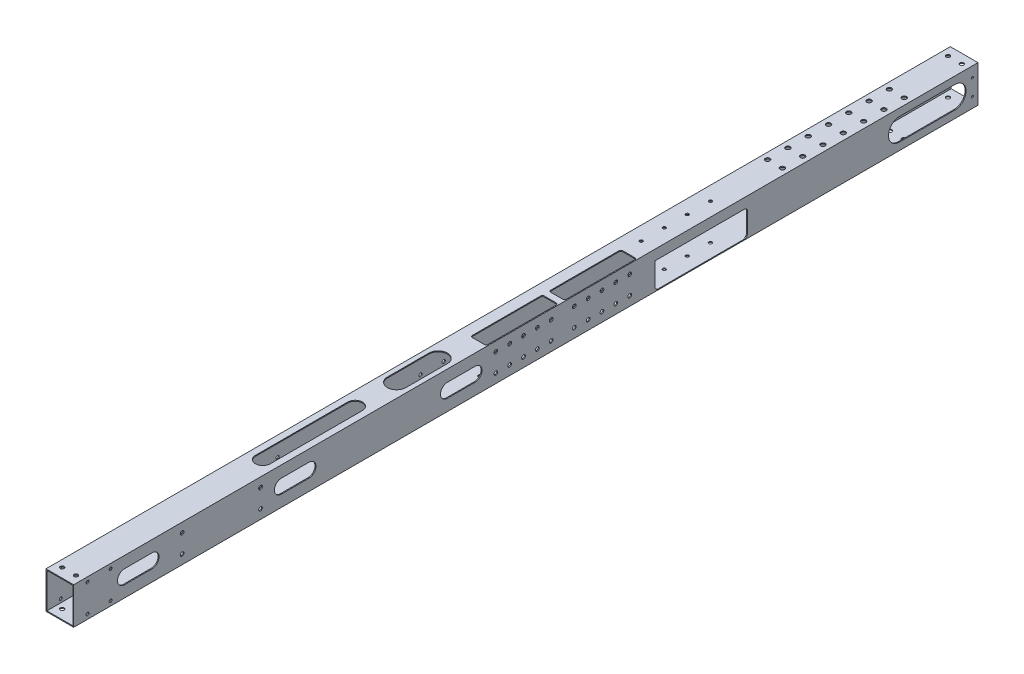
from build123d import *

# Parameters (mm, degrees)
SKETCH_1_W           = 30
SKETCH_1_H           = 40
SKETCH_1_W_2         = 28
SKETCH_1_H_2         = 38
EXTRUDE_1_DEPTH      = 940
SKETCH_5_R           = 2.5
CUT_EXTRUDE_3_DEPTH  = 941.97024395
CUT_EXTRUDE_4_DEPTH  = 1
SKETCH_7_R           = 1.75
CUT_EXTRUDE_5_DEPTH  = 1
SKETCH_17_W          = 30
SKETCH_17_H          = 40
SKETCH_17_W_2        = 28
SKETCH_17_H_2        = 38
EXTRUDE_2_DEPTH      = 20
SKETCH_18_W          = 30
SKETCH_18_H          = 40
SKETCH_18_W_2        = 28
SKETCH_18_H_2        = 38
EXTRUDE_3_DEPTH      = 20
SKETCH_19_R          = 2.1
CUT_EXTRUDE_16_DEPTH = 961.950050731
SKETCH_20_R          = 1.6
CUT_EXTRUDE_17_DEPTH = 961.67684473
SKETCH_26_R          = 2
CUT_EXTRUDE_22_DEPTH = 961.67684473
CUT_EXTRUDE_START    = -20
SKETCH_34_R          = 1.75
CUT_EXTRUDE_29_DEPTH = 20
SKETCH_35_R          = 1.5
CUT_EXTRUDE_30_DEPTH = 10
CUT_EXTRUDE_31_DEPTH = 10
SKETCH_37_R          = 1.65
CUT_EXTRUDE_32_DEPTH = 52
SKETCH_40_W          = 100
SKETCH_40_H          = 28
CUT_EXTRUDE_34_DEPTH = 10
EXTRUDE_5_DEPTH      = 1
SKETCH_43_W          = 38.522995696
SKETCH_43_H          = 13.00002022
EXTRUDE_6_DEPTH      = 1
FILLET_1_R           = 3
CUT_EXTRUDE_35_DEPTH = 10
SKETCH_45_R          = 1.1
CUT_EXTRUDE_36_DEPTH = 71
CUT_EXTRUDE_37_DEPTH = 10
SKETCH_47_W          = 19.401524295
SKETCH_47_H          = 15.190340728
EXTRUDE_7_DEPTH      = 1
SKETCH_48_R          = 2
CUT_EXTRUDE_38_DEPTH = 51
CUT_EXTRUDE_39_DEPTH = 11
SKETCH_51_W          = 17
SKETCH_51_H          = 78
CUT_EXTRUDE_40_DEPTH = 11
FILLET_2_R           = 2


with BuildPart() as part:
    # 草图1 → 凸台-拉伸1 (new body)
    with BuildSketch(Plane.XY):
        Rectangle(SKETCH_1_W, SKETCH_1_H)
        Rectangle(SKETCH_1_W_2, SKETCH_1_H_2, mode=Mode.SUBTRACT)
    extrude(amount=EXTRUDE_1_DEPTH)

    # 草图5 → 切除-拉伸3 (cut, through all)
    with BuildSketch(Plane.XZ.offset(20)):
        with Locations((-8, 53)):
            Circle(SKETCH_5_R)
        with Locations((8, 53)):
            Circle(SKETCH_5_R)
        with Locations((-8, 97)):
            Circle(SKETCH_5_R)
        with Locations((8, 97)):
            Circle(SKETCH_5_R)
        with Locations((-8, 119)):
            Circle(SKETCH_5_R)
        with Locations((8, 119)):
            Circle(SKETCH_5_R)
        with Locations((-8, 141)):
            Circle(SKETCH_5_R)
        with Locations((8, 141)):
            Circle(SKETCH_5_R)
        with Locations((-8, 163)):
            Circle(SKETCH_5_R)
        with Locations((8, 163)):
            Circle(SKETCH_5_R)
        with Locations((-8, 185)):
            Circle(SKETCH_5_R)
        with Locations((8, 185)):
            Circle(SKETCH_5_R)
        with Locations((-8, 75)):
            Circle(SKETCH_5_R)
        with Locations((8, 75)):
            Circle(SKETCH_5_R)
    extrude(amount=-CUT_EXTRUDE_3_DEPTH, mode=Mode.SUBTRACT)

    # 草图6 → 切除-拉伸4 (cut)
    with BuildSketch(Plane(origin=(15, 0, 0), x_dir=(0, 0, -1), z_dir=(1, 0, 0))):
        with BuildLine():
            Line((-345, -7.5), (-375, -7.5))
            ThreePointArc((-375, -7.5), (-382.5, 0), (-375, 7.5))
            Line((-375, 7.5), (-345, 7.5))
            ThreePointArc((-345, 7.5), (-337.5, 0), (-345, -7.5))
        make_face()
        with BuildLine():
            Line((-525, -7.5), (-555, -7.5))
            ThreePointArc((-555, -7.5), (-562.5, 0), (-555, 7.5))
            Line((-555, 7.5), (-525, 7.5))
            ThreePointArc((-525, 7.5), (-517.5, 0), (-525, -7.5))
        make_face()
        with BuildLine():
            Line((-705, -7.5), (-735, -7.5))
            ThreePointArc((-735, -7.5), (-742.5, 0), (-735, 7.5))
            Line((-735, 7.5), (-705, 7.5))
            ThreePointArc((-705, 7.5), (-697.5, 0), (-705, -7.5))
        make_face()
    extrude(amount=-CUT_EXTRUDE_4_DEPTH, mode=Mode.SUBTRACT)

    # 草图7 → 切除-拉伸5 (cut)
    with BuildSketch(Plane.ZY.offset(15)):
        with Locations((350, 0)):
            Circle(SKETCH_7_R)
        with Locations((375, 0)):
            Circle(SKETCH_7_R)
        with Locations((530, 0)):
            Circle(SKETCH_7_R)
        with Locations((555, 0)):
            Circle(SKETCH_7_R)
        with Locations((710, 0)):
            Circle(SKETCH_7_R)
        with Locations((735, 0)):
            Circle(SKETCH_7_R)
    extrude(amount=-CUT_EXTRUDE_5_DEPTH, mode=Mode.SUBTRACT)

    # 草图17 → 凸台-拉伸2 (add)
    with BuildSketch(Plane.XY.offset(940)):
        Rectangle(SKETCH_17_W, SKETCH_17_H)
        Rectangle(SKETCH_17_W_2, SKETCH_17_H_2, mode=Mode.SUBTRACT)
    extrude(amount=EXTRUDE_2_DEPTH)

    # 草图18 → 凸台-拉伸3 (add)
    with BuildSketch(Plane(origin=(0, 0, 0), x_dir=(-1, 0, 0), z_dir=(0, 0, -1))):
        Rectangle(SKETCH_18_W, SKETCH_18_H)
        Rectangle(SKETCH_18_W_2, SKETCH_18_H_2, mode=Mode.SUBTRACT)
    extrude(amount=EXTRUDE_3_DEPTH)

    # 草图19 → 切除-拉伸16 (cut, through all)
    with BuildSketch(Plane(origin=(0, 20, 0), x_dir=(1, 0, 0), z_dir=(0, 1, 0))):
        with Locations((-7.5, -950)):
            Circle(SKETCH_19_R)
        with Locations((7.5, -950)):
            Circle(SKETCH_19_R)
        with Locations((-7.5, 10)):
            Circle(SKETCH_19_R)
        with Locations((7.5, 10)):
            Circle(SKETCH_19_R)
    extrude(amount=-CUT_EXTRUDE_16_DEPTH, mode=Mode.SUBTRACT)

    # 草图20 → 切除-拉伸17 (cut, through all)
    with BuildSketch(Plane(origin=(15, 0, 0), x_dir=(0, 0, -1), z_dir=(1, 0, 0))):
        with Locations((-945, 15)):
            Circle(SKETCH_20_R)
        with Locations((-920, 15)):
            Circle(SKETCH_20_R)
        with Locations((-920, -15)):
            Circle(SKETCH_20_R)
        with Locations((-945, -15)):
            Circle(SKETCH_20_R)
    extrude(amount=-CUT_EXTRUDE_17_DEPTH, mode=Mode.SUBTRACT)

    # 草图26 → 切除-拉伸22 (cut, through all)
    with BuildSketch(Plane(origin=(15, 0, 0), x_dir=(0, 0, -1), z_dir=(1, 0, 0))):
        with Locations((-842.5, 10)):
            Circle(SKETCH_26_R)
        with Locations((-842.5, -10)):
            Circle(SKETCH_26_R)
        with Locations((-757.5, -10)):
            Circle(SKETCH_26_R)
        with Locations((-757.5, 10)):
            Circle(SKETCH_26_R)
    extrude(amount=-CUT_EXTRUDE_22_DEPTH, mode=Mode.SUBTRACT)

    # 草图34 → 切除-拉伸29 (cut)
    with BuildSketch(Plane(origin=(15, 0, 0), x_dir=(0, 0, -1), z_dir=(1, 0, 0)).offset(CUT_EXTRUDE_START)):
        with Locations((-905, 0)):
            Circle(SKETCH_34_R)
        with Locations((-880, 0)):
            Circle(SKETCH_34_R)
    extrude(amount=-CUT_EXTRUDE_29_DEPTH, mode=Mode.SUBTRACT)

    # 草图35 → 切除-拉伸30 (cut)
    with BuildSketch(Plane.XZ.offset(20)):
        with Locations((5, 720)):
            Circle(SKETCH_35_R)
        with Locations((5, 700)):
            Circle(SKETCH_35_R)
        with Locations((5, 680)):
            Circle(SKETCH_35_R)
        with Locations((5, 660)):
            Circle(SKETCH_35_R)
        with Locations((5, 640)):
            Circle(SKETCH_35_R)
        with Locations((5, 740)):
            Circle(SKETCH_35_R)
    extrude(amount=-CUT_EXTRUDE_30_DEPTH, mode=Mode.SUBTRACT)

    # 草图36 → 切除-拉伸31 (cut)
    with BuildSketch(Plane(origin=(0, 20, 0), x_dir=(1, 0, 0), z_dir=(0, 1, 0))):
        with BuildLine():
            Line((8, -640), (8, -740))
            ThreePointArc((8, -740), (0, -748), (-8, -740))
            Line((-8, -740), (-8, -640))
            ThreePointArc((-8, -640), (0, -632), (8, -640))
        make_face()
    extrude(amount=-CUT_EXTRUDE_31_DEPTH, mode=Mode.SUBTRACT)

    # 草图37 → 切除-拉伸32 (cut)
    with BuildSketch(Plane(origin=(0, 20, 0), x_dir=(1, 0, 0), z_dir=(0, 1, 0))):
        with Locations((0, -255)):
            Circle(SKETCH_37_R)
        with Locations((0, -280)):
            Circle(SKETCH_37_R)
        with Locations((0, -330)):
            Circle(SKETCH_37_R)
        with Locations((0, -305)):
            Circle(SKETCH_37_R)
        with Locations((0, -355)):
            Circle(SKETCH_37_R)
        with Locations((0, -380)):
            Circle(SKETCH_37_R)
        with Locations((0, -405)):
            Circle(SKETCH_37_R)
        with Locations((0, -455)):
            Circle(SKETCH_37_R)
        with Locations((0, -480)):
            Circle(SKETCH_37_R)
        with Locations((0, -505)):
            Circle(SKETCH_37_R)
        with Locations((0, -555)):
            Circle(SKETCH_37_R)
        with Locations((0, -580)):
            Circle(SKETCH_37_R)
    extrude(amount=-CUT_EXTRUDE_32_DEPTH, mode=Mode.SUBTRACT)

    # 草图40 → 切除-拉伸34 (cut)
    with BuildSketch(Plane(origin=(15, 0, 0), x_dir=(0, 0, -1), z_dir=(1, 0, 0))):
        with Locations((-280, -5)):
            Rectangle(SKETCH_40_W, SKETCH_40_H)
    extrude(amount=-CUT_EXTRUDE_34_DEPTH, mode=Mode.SUBTRACT)

    # 草图42 → 凸台-拉伸5 (add)
    with BuildSketch(Plane(origin=(15, 0, 0), x_dir=(0, 0, -1), z_dir=(1, 0, 0))):
        Polygon((-350, -8.24794841), (-350, -4), (-334.23295051, -4), (-334.23295051, 12.222841732), (-383.610977641, 12.222841732), (-383.610977641, -8.24794841), align=None)
    extrude(amount=-EXTRUDE_5_DEPTH)

    # 草图43 → 凸台-拉伸6 (add)
    with BuildSketch(Plane.ZY.offset(15)):
        with Locations((362.400416305, 1.435266839)):
            Rectangle(SKETCH_43_W, SKETCH_43_H)
    extrude(amount=-EXTRUDE_6_DEPTH)

    # 圆角1
    fillet_1_edges = [part.edges().sort_by_distance(p)[0] for p in [
        (14.5, -19, 230),
        (14.5, 9, 230),
        (14.5, -19, 330),
    ]]
    fillet(fillet_1_edges, radius=FILLET_1_R)

    # 草图44 → 切除-拉伸35 (cut)
    with BuildSketch(Plane(origin=(15, 0, 0), x_dir=(0, 0, -1), z_dir=(1, 0, 0))):
        with BuildLine():
            ThreePointArc((-875, -7.5), (-867.5, 0), (-875, 7.5))
            Line((-875, 7.5), (-905, 7.5))
            ThreePointArc((-905, 7.5), (-912.5, 0), (-905, -7.5))
            Line((-905, -7.5), (-875, -7.5))
        make_face()
    extrude(amount=-CUT_EXTRUDE_35_DEPTH, mode=Mode.SUBTRACT)

    # 草图45 → 切除-拉伸36 (cut)
    with BuildSketch(Plane(origin=(15, 0, 0), x_dir=(0, 0, -1), z_dir=(1, 0, 0))):
        with Locations((-31.199995376, 9.020444537)):
            Circle(SKETCH_45_R)
        with Locations((14, 9)):
            Circle(SKETCH_45_R)
        with Locations((14, -9)):
            Circle(SKETCH_45_R)
        with Locations((-31.199995376, -9.020444537)):
            Circle(SKETCH_45_R)
    extrude(amount=-CUT_EXTRUDE_36_DEPTH, mode=Mode.SUBTRACT)

    # 草图46 → 切除-拉伸37 (cut)
    with BuildSketch(Plane(origin=(15, 0, 0), x_dir=(0, 0, -1), z_dir=(1, 0, 0))):
        with BuildLine():
            Line((-65, 12), (-5, 12))
            ThreePointArc((-5, 12), (7, 0), (-5, -12))
            Line((-5, -12), (-65, -12))
            ThreePointArc((-65, -12), (-77, 0), (-65, 12))
        make_face()
    extrude(amount=-CUT_EXTRUDE_37_DEPTH, mode=Mode.SUBTRACT)

    # 草图47 → 凸台-拉伸7 (add)
    with BuildSketch(Plane(origin=(15, 0, 0), x_dir=(0, 0, -1), z_dir=(1, 0, 0))):
        with Locations((-344.839367804, -3.918550489)):
            Rectangle(SKETCH_47_W, SKETCH_47_H)
    extrude(amount=-EXTRUDE_7_DEPTH)

    # 草图48 → 切除-拉伸38 (cut)
    with BuildSketch(Plane(origin=(15, 0, 0), x_dir=(0, 0, -1), z_dir=(1, 0, 0))):
        with Locations((-842.5, -10)):
            Circle(SKETCH_48_R)
        with Locations((-842.5, 10)):
            Circle(SKETCH_48_R)
        with Locations((-472.5, -10)):
            Circle(SKETCH_48_R)
        with Locations((-472.5, 10)):
            Circle(SKETCH_48_R)
        with Locations((-387.5, -10)):
            Circle(SKETCH_48_R)
        with Locations((-387.5, 10)):
            Circle(SKETCH_48_R)
        with Locations((-457.5, -10)):
            Circle(SKETCH_48_R)
        with Locations((-457.5, 10)):
            Circle(SKETCH_48_R)
        with Locations((-372.5, -10)):
            Circle(SKETCH_48_R)
        with Locations((-372.5, 10)):
            Circle(SKETCH_48_R)
        with Locations((-442.5, -10)):
            Circle(SKETCH_48_R)
        with Locations((-442.5, 10)):
            Circle(SKETCH_48_R)
        with Locations((-357.5, -10)):
            Circle(SKETCH_48_R)
        with Locations((-357.5, 10)):
            Circle(SKETCH_48_R)
        with Locations((-402.5, -10)):
            Circle(SKETCH_48_R)
        with Locations((-402.5, 10)):
            Circle(SKETCH_48_R)
        with Locations((-487.5, -10)):
            Circle(SKETCH_48_R)
        with Locations((-487.5, 10)):
            Circle(SKETCH_48_R)
        with Locations((-417.5, -10)):
            Circle(SKETCH_48_R)
        with Locations((-417.5, 10)):
            Circle(SKETCH_48_R)
        with Locations((-502.5, -10)):
            Circle(SKETCH_48_R)
        with Locations((-502.5, 10)):
            Circle(SKETCH_48_R)
    extrude(amount=-CUT_EXTRUDE_38_DEPTH, mode=Mode.SUBTRACT)

    # 草图49 → 切除-拉伸39 (cut)
    with BuildSketch(Plane(origin=(0, 20, 0), x_dir=(1, 0, 0), z_dir=(0, 1, 0))):
        with BuildLine():
            Line((10, -550), (10, -595))
            ThreePointArc((10, -595), (0, -605), (-10, -595))
            Line((-10, -595), (-10, -550))
            ThreePointArc((-10, -550), (0, -540), (10, -550))
        make_face()
    extrude(amount=-CUT_EXTRUDE_39_DEPTH, mode=Mode.SUBTRACT)

    # 草图51 → 切除-拉伸40 (cut)
    with BuildSketch(Plane(origin=(0, 20, 0), x_dir=(1, 0, 0), z_dir=(0, 1, 0))):
        with Locations((5.5, -473)):
            Rectangle(SKETCH_51_W, SKETCH_51_H)
        with Locations((5.5, -388)):
            Rectangle(SKETCH_51_W, SKETCH_51_H)
    extrude(amount=-CUT_EXTRUDE_40_DEPTH, mode=Mode.SUBTRACT)

    # 圆角2
    fillet_2_edges = [part.edges().sort_by_distance(p)[0] for p in [
        (14, 19.5, 427),
        (14, 19.5, 349),
        (14, 19.5, 512),
        (14, 19.5, 434),
        (-3, 19.5, 434),
        (-3, 19.5, 512),
        (-3, 19.5, 427),
        (-3, 19.5, 349),
    ]]
    fillet(fillet_2_edges, radius=FILLET_2_R)


solid = part.part
